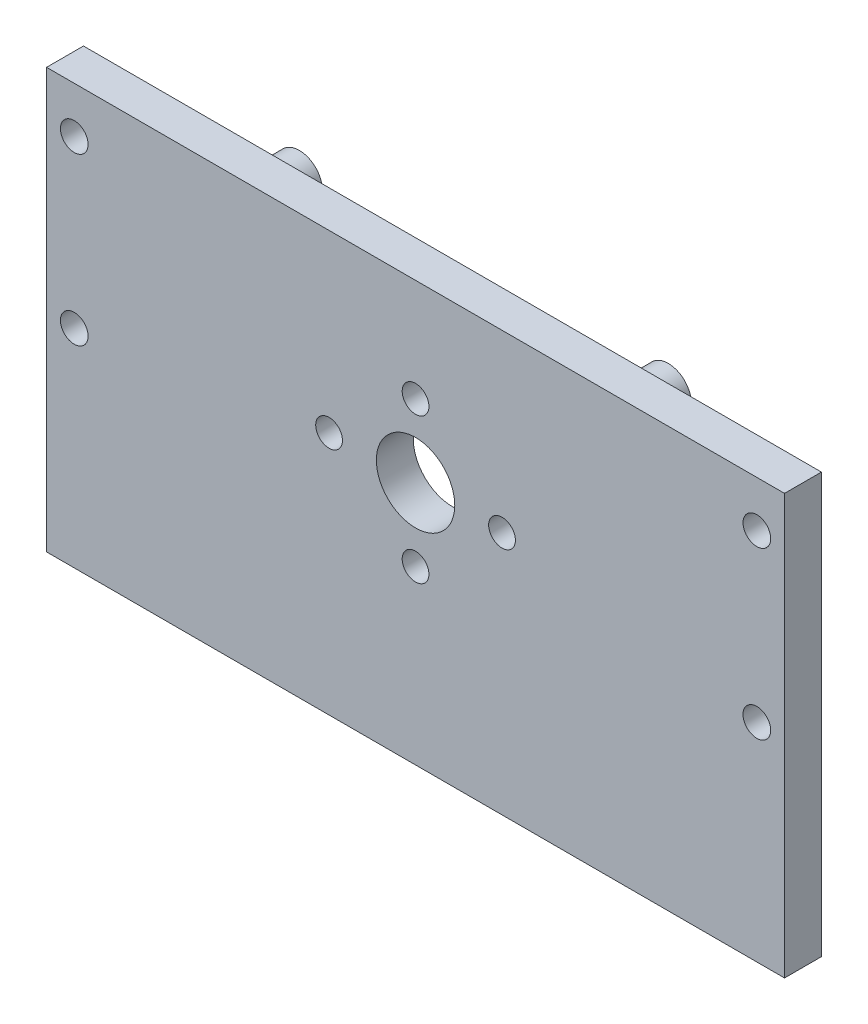
from build123d import *

# Parameters (mm, degrees)
BOSS_EXTRUDE5_DEPTH      = 3
BOSS_EXTRUDE5_DEPTH_BACK = 1
SKETCH2_W                = 80
SKETCH2_H                = 45.5
SKETCH2_R                = 2.5
SKETCH2_R_2              = 1.5
SKETCH2_R_3              = 4.25
SKETCH2_W_2              = 37.2
SKETCH2_H_2              = 4
SKETCH2_R_4              = 1.4
SKETCH2_8_R              = 2.5
SKETCH2_8_R_2            = 1.4
SKETCH2_8_W              = 37.2
SKETCH2_8_H              = 4
BOSS_EXTRUDE6_DEPTH      = 4.4
SKETCH7_R                = 1.45
CUT_EXTRUDE3_DEPTH       = 47.19050227
FILLET1_R                = 1


with BuildPart() as part:
    # Sketch2 → Boss-Extrude5 (new, two sides: drawn at the far end of the back side and taken through both)
    # profile 1 of 18: a face of its own
    with BuildSketch(Plane.XY.offset(-BOSS_EXTRUDE5_DEPTH_BACK)):
        Rectangle(SKETCH2_W, SKETCH2_H)
        with Locations((-8.718645076, -4.968645076)):
            Circle(SKETCH2_R, mode=Mode.SUBTRACT)
        with Locations((8.718645076, -4.968645076)):
            Circle(SKETCH2_R, mode=Mode.SUBTRACT)
        with Locations((8.718645076, 12.468645076)):
            Circle(SKETCH2_R, mode=Mode.SUBTRACT)
        with Locations((-8.718645076, 12.468645076)):
            Circle(SKETCH2_R, mode=Mode.SUBTRACT)
        with Locations((20, -19.25)):
            Circle(SKETCH2_R, mode=Mode.SUBTRACT)
        with Locations((-20, -19.25)):
            Circle(SKETCH2_R, mode=Mode.SUBTRACT)
        with Locations((20, 18.75)):
            Circle(SKETCH2_R, mode=Mode.SUBTRACT)
        with Locations((-20, 18.75)):
            Circle(SKETCH2_R, mode=Mode.SUBTRACT)
        with Locations((-37, 17.75)):
            Circle(SKETCH2_R_2, mode=Mode.SUBTRACT)
        with Locations((-37, -0.25)):
            Circle(SKETCH2_R_2, mode=Mode.SUBTRACT)
        with Locations((37, -0.25)):
            Circle(SKETCH2_R_2, mode=Mode.SUBTRACT)
        with Locations((37, 17.75)):
            Circle(SKETCH2_R_2, mode=Mode.SUBTRACT)
        with Locations((0, 3.75)):
            Circle(SKETCH2_R_3, mode=Mode.SUBTRACT)
        with Locations((-0.005934964, -9.695257034)):
            Rectangle(SKETCH2_W_2, SKETCH2_H_2, mode=Mode.SUBTRACT)
    # profile 2 of 18: a face of its own
    with BuildSketch(Plane.XY.offset(-BOSS_EXTRUDE5_DEPTH_BACK)):
        with Locations((-20, 18.75)):
            Circle(SKETCH2_R)
        with Locations((-20, 18.75)):
            Circle(SKETCH2_R_4, mode=Mode.SUBTRACT)
    # profile 3 of 18: a face of its own
    with BuildSketch(Plane.XY.offset(-BOSS_EXTRUDE5_DEPTH_BACK)):
        with Locations((-20, 18.75)):
            Circle(SKETCH2_R_4)
    # profile 4 of 18: a face of its own
    with BuildSketch(Plane.XY.offset(-BOSS_EXTRUDE5_DEPTH_BACK)):
        with Locations((-8.718645076, 12.468645076)):
            Circle(SKETCH2_R)
        with Locations((-8.718645076, 12.468645076)):
            Circle(SKETCH2_R_2, mode=Mode.SUBTRACT)
    # profile 5 of 18: a face of its own
    with BuildSketch(Plane.XY.offset(-BOSS_EXTRUDE5_DEPTH_BACK)):
        with Locations((-8.718645076, 12.468645076)):
            Circle(SKETCH2_R_2)
    # profile 6 of 18: a face of its own
    with BuildSketch(Plane.XY.offset(-BOSS_EXTRUDE5_DEPTH_BACK)):
        with Locations((8.718645076, 12.468645076)):
            Circle(SKETCH2_R)
        with Locations((8.718645076, 12.468645076)):
            Circle(SKETCH2_R_2, mode=Mode.SUBTRACT)
    # profile 7 of 18: a face of its own
    with BuildSketch(Plane.XY.offset(-BOSS_EXTRUDE5_DEPTH_BACK)):
        with Locations((8.718645076, 12.468645076)):
            Circle(SKETCH2_R_2)
    # profile 8 of 18: a face of its own
    with BuildSketch(Plane.XY.offset(-BOSS_EXTRUDE5_DEPTH_BACK)):
        with Locations((-8.718645076, -4.968645076)):
            Circle(SKETCH2_R)
        with Locations((-8.718645076, -4.968645076)):
            Circle(SKETCH2_R_2, mode=Mode.SUBTRACT)
    # profile 9 of 18: a face of its own
    with BuildSketch(Plane.XY.offset(-BOSS_EXTRUDE5_DEPTH_BACK)):
        with Locations((-8.718645076, -4.968645076)):
            Circle(SKETCH2_R_2)
    # profile 10 of 18: a face of its own
    with BuildSketch(Plane.XY.offset(-BOSS_EXTRUDE5_DEPTH_BACK)):
        with Locations((8.718645076, -4.968645076)):
            Circle(SKETCH2_R)
        with Locations((8.718645076, -4.968645076)):
            Circle(SKETCH2_R_2, mode=Mode.SUBTRACT)
    # profile 11 of 18: a face of its own
    with BuildSketch(Plane.XY.offset(-BOSS_EXTRUDE5_DEPTH_BACK)):
        with Locations((8.718645076, -4.968645076)):
            Circle(SKETCH2_R_2)
    # profile 12 of 18: a face of its own
    with BuildSketch(Plane.XY.offset(-BOSS_EXTRUDE5_DEPTH_BACK)):
        with Locations((20, 18.75)):
            Circle(SKETCH2_R)
        with Locations((20, 18.75)):
            Circle(SKETCH2_R_4, mode=Mode.SUBTRACT)
    # profile 13 of 18: a face of its own
    with BuildSketch(Plane.XY.offset(-BOSS_EXTRUDE5_DEPTH_BACK)):
        with Locations((20, 18.75)):
            Circle(SKETCH2_R_4)
    # profile 14 of 18: a face of its own
    with BuildSketch(Plane.XY.offset(-BOSS_EXTRUDE5_DEPTH_BACK)):
        with Locations((-0.005934964, -9.695257034)):
            Rectangle(SKETCH2_W_2, SKETCH2_H_2)
    # profile 15 of 18: a face of its own
    with BuildSketch(Plane.XY.offset(-BOSS_EXTRUDE5_DEPTH_BACK)):
        with Locations((20, -19.25)):
            Circle(SKETCH2_R)
        with Locations((20, -19.25)):
            Circle(SKETCH2_R_4, mode=Mode.SUBTRACT)
    # profile 16 of 18: a face of its own
    with BuildSketch(Plane.XY.offset(-BOSS_EXTRUDE5_DEPTH_BACK)):
        with Locations((20, -19.25)):
            Circle(SKETCH2_R_4)
    # profile 17 of 18: a face of its own
    with BuildSketch(Plane.XY.offset(-BOSS_EXTRUDE5_DEPTH_BACK)):
        with Locations((-20, -19.25)):
            Circle(SKETCH2_R)
        with Locations((-20, -19.25)):
            Circle(SKETCH2_R_4, mode=Mode.SUBTRACT)
    # profile 18 of 18: a face of its own
    with BuildSketch(Plane.XY.offset(-BOSS_EXTRUDE5_DEPTH_BACK)):
        with Locations((-20, -19.25)):
            Circle(SKETCH2_R_4)
    extrude(amount=BOSS_EXTRUDE5_DEPTH + BOSS_EXTRUDE5_DEPTH_BACK)

    # Sketch2<8> → Boss-Extrude6 (add)
    # profile 1 of 5: a face of its own
    with BuildSketch(Plane.XY):
        with Locations((20, 18.75)):
            Circle(SKETCH2_8_R)
        with Locations((20, 18.75)):
            Circle(SKETCH2_8_R_2, mode=Mode.SUBTRACT)
    # profile 2 of 5: a face of its own
    with BuildSketch(Plane.XY):
        with Locations((-20, 18.75)):
            Circle(SKETCH2_8_R)
        with Locations((-20, 18.75)):
            Circle(SKETCH2_8_R_2, mode=Mode.SUBTRACT)
    # profile 3 of 5: a face of its own
    with BuildSketch(Plane.XY):
        with Locations((-20, -19.25)):
            Circle(SKETCH2_8_R)
        with Locations((-20, -19.25)):
            Circle(SKETCH2_8_R_2, mode=Mode.SUBTRACT)
    # profile 4 of 5: a face of its own
    with BuildSketch(Plane.XY):
        with Locations((-0.005934964, -9.695257034)):
            Rectangle(SKETCH2_8_W, SKETCH2_8_H)
    # profile 5 of 5: a face of its own
    with BuildSketch(Plane.XY):
        with Locations((20, -19.25)):
            Circle(SKETCH2_8_R)
        with Locations((20, -19.25)):
            Circle(SKETCH2_8_R_2, mode=Mode.SUBTRACT)
    extrude(amount=-BOSS_EXTRUDE6_DEPTH)

    # Sketch7 → Cut-Extrude3 (cut, through all)
    with BuildSketch(Plane(origin=(0, 0, -1), x_dir=(-1, 0, 0), z_dir=(0, 0, -1))):
        with Locations((0, -4.125)):
            Circle(SKETCH7_R)
        with Locations((9.375, 3.75)):
            Circle(SKETCH7_R)
        with Locations((0, 11.625)):
            Circle(SKETCH7_R)
        with Locations((-9.375, 3.75)):
            Circle(SKETCH7_R)
    extrude(amount=-CUT_EXTRUDE3_DEPTH, mode=Mode.SUBTRACT)

    # Fillet1
    fillet1_edges = [part.edges().sort_by_distance(p)[0] for p in [
        (17.5, 18.75, -1),
        (-22.5, 18.75, -1),
        (-22.5, -19.25, -1),
        (17.5, -19.25, -1),
    ]]
    fillet(fillet1_edges, radius=FILLET1_R - 0.0001)  # a hair under: the kernel refuses the full size


solid = part.part
